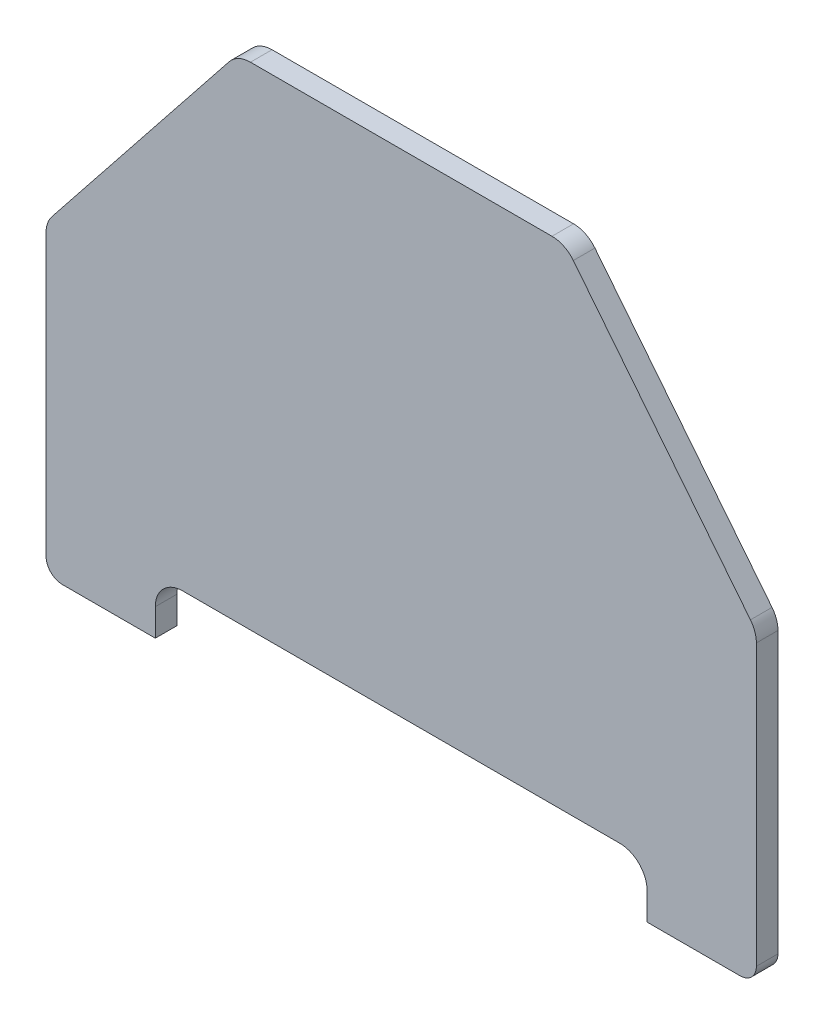
from build123d import *

# Parameters (mm, degrees)
BOSS_EXTRUDE2_DEPTH = 3.95
FILLET1_R           = 5
FILLET2_R           = 3


with BuildPart() as part:
    # Sketch1 → Boss-Extrude2 (new body)
    with BuildSketch(Plane.XY):
        Polygon((0, 56), (35, 100), (95, 100), (130, 56), (130, 0), (110, 0), (110, 10), (20, 10), (20, 0), (0, 0), align=None)
    extrude(amount=BOSS_EXTRUDE2_DEPTH)

    # Fillet1
    fillet1_edges = [part.edges().sort_by_distance(p)[0] for p in [
        (130, 56, 1.975),
        (95, 100, 1.975),
        (35, 100, 1.975),
        (0, 56, 1.975),
        (110, 10, 1.975),
        (20, 10, 1.975),
    ]]
    fillet(fillet1_edges, radius=FILLET1_R)

    # Fillet2
    fillet2_edges = [part.edges().sort_by_distance(p)[0] for p in [
        (130, 0, 1.975),
        (0, 0, 1.975),
    ]]
    fillet(fillet2_edges, radius=FILLET2_R)


solid = part.part
